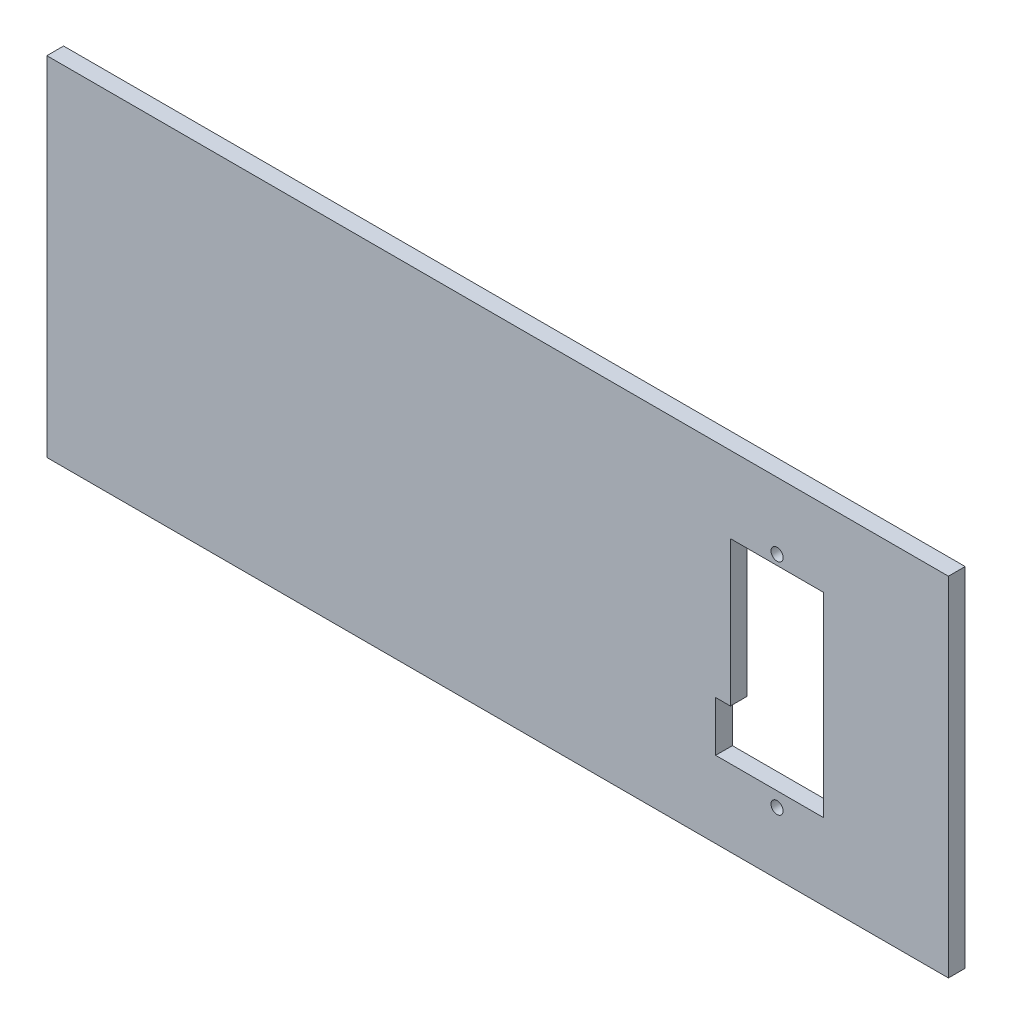
from build123d import *

# Parameters (mm, degrees)
SKETCH1_W           = 342
SKETCH1_H           = 132
SKETCH1_R           = 2.3
BOSS_EXTRUDE1_DEPTH = 6.35


with BuildPart() as part:
    # Sketch1 → Boss-Extrude1 (new body)
    with BuildSketch(Plane.XY):
        with Locations((171, 66)):
            Rectangle(SKETCH1_W, SKETCH1_H)
        with Locations((277, 106.7)):
            Circle(SKETCH1_R, mode=Mode.SUBTRACT)
        with Locations((277, 23.5)):
            Circle(SKETCH1_R, mode=Mode.SUBTRACT)
        Polygon((294.7, 29), (253.7, 29), (253.7, 48), (259.3, 48), (259.3, 103), (294.7, 103), align=None, mode=Mode.SUBTRACT)
    extrude(amount=BOSS_EXTRUDE1_DEPTH)


solid = part.part
